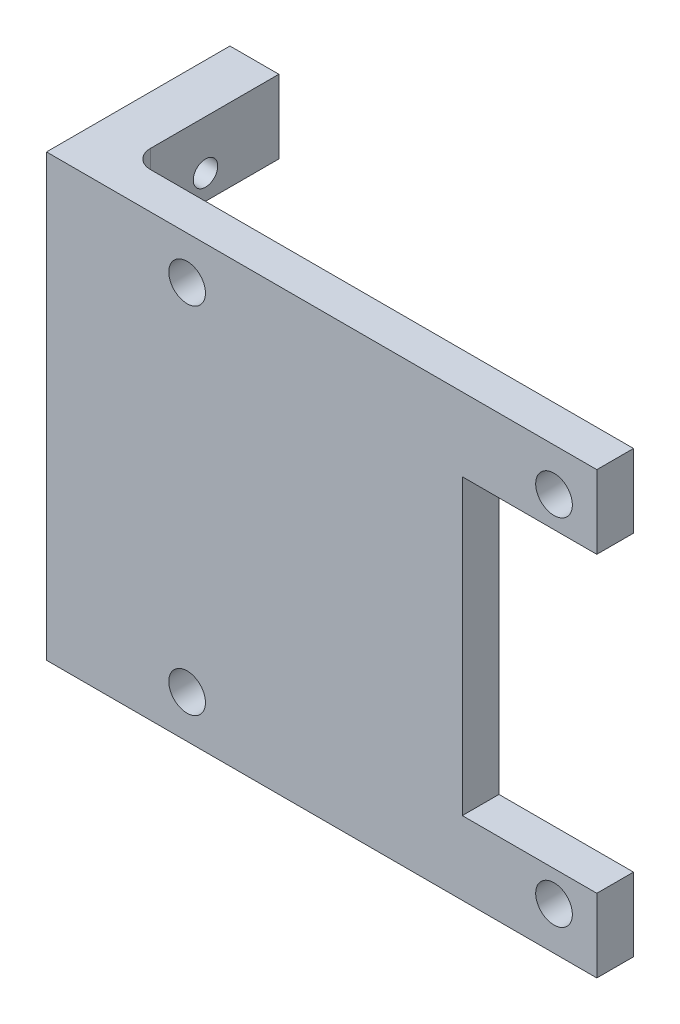
from build123d import *

# Parameters (mm, degrees)
BOSS_EXTRUDE1_DEPTH = 3
CUT_EXTRUDE1_REACH  = 27.986
SKETCH2_R           = 1.5
SKETCH6_W           = 3
SKETCH6_H           = 36
BOSS_EXTRUDE3_DEPTH = 8
SKETCH9_W           = 4
SKETCH9_H           = 6
BOSS_EXTRUDE4_DEPTH = 12
CUT_EXTRUDE2_REACH  = 48.357
SKETCH10_R          = 1
FILLET1_R           = 1.5


with BuildPart() as part:
    # Sketch1 → Boss-Extrude1 (new body)
    with BuildSketch(Plane.XY):
        Polygon((-18.5, 18), (18.5, 18), (18.5, 12), (7.5, 12), (7.5, -12), (18.5, -12), (18.5, -18), (-18.5, -18), align=None)
    extrude(amount=BOSS_EXTRUDE1_DEPTH)

    # Sketch2 → Cut-Extrude1 (cut, up to next)
    with BuildSketch(Plane.XY, mode=Mode.PRIVATE) as cut_extrude1_sk1:
        with Locations((-15, -14.5)):
            Circle(SKETCH2_R)
    cut_extrude1_tool1 = extrude(cut_extrude1_sk1.sketch, amount=CUT_EXTRUDE1_REACH, mode=Mode.PRIVATE) & part.part
    # Sketch2 → Cut-Extrude1 (cut, up to next)
    with BuildSketch(Plane.XY, mode=Mode.PRIVATE) as cut_extrude1_sk2:
        with Locations((15, -14.5)):
            Circle(SKETCH2_R)
    cut_extrude1_tool2 = extrude(cut_extrude1_sk2.sketch, amount=CUT_EXTRUDE1_REACH, mode=Mode.PRIVATE) & part.part
    # Sketch2 → Cut-Extrude1 (cut, up to next)
    with BuildSketch(Plane.XY, mode=Mode.PRIVATE) as cut_extrude1_sk3:
        with Locations((15, 14.5)):
            Circle(SKETCH2_R)
    cut_extrude1_tool3 = extrude(cut_extrude1_sk3.sketch, amount=CUT_EXTRUDE1_REACH, mode=Mode.PRIVATE) & part.part
    # Sketch2 → Cut-Extrude1 (cut, up to next)
    with BuildSketch(Plane.XY, mode=Mode.PRIVATE) as cut_extrude1_sk4:
        with Locations((-15, 14.5)):
            Circle(SKETCH2_R)
    cut_extrude1_tool4 = extrude(cut_extrude1_sk4.sketch, amount=CUT_EXTRUDE1_REACH, mode=Mode.PRIVATE) & part.part
    add(cut_extrude1_tool1.solids().sort_by_distance((-15, -14.5, 0))[0], mode=Mode.SUBTRACT)
    add(cut_extrude1_tool2.solids().sort_by_distance((15, -14.5, 0))[0], mode=Mode.SUBTRACT)
    add(cut_extrude1_tool3.solids().sort_by_distance((15, 14.5, 0))[0], mode=Mode.SUBTRACT)
    add(cut_extrude1_tool4.solids().sort_by_distance((-15, 14.5, 0))[0], mode=Mode.SUBTRACT)

    # Sketch6 → Boss-Extrude3 (add)
    with BuildSketch(Plane.ZY.offset(18.5)):
        with Locations((1.5, 0)):
            Rectangle(SKETCH6_W, SKETCH6_H)
    extrude(amount=BOSS_EXTRUDE3_DEPTH)

    # Sketch9 → Boss-Extrude4 (add)
    with BuildSketch(Plane.XY):
        with Locations((-24.5, 15)):
            Rectangle(SKETCH9_W, SKETCH9_H)
        with Locations((-24.5, -15)):
            Rectangle(SKETCH9_W, SKETCH9_H)
    extrude(amount=-BOSS_EXTRUDE4_DEPTH)

    # Sketch10 → Cut-Extrude2 (cut, up to next)
    with BuildSketch(Plane(origin=(-22.5, 0, 0), x_dir=(0, 0, -1), z_dir=(1, 0, 0)), mode=Mode.PRIVATE) as cut_extrude2_sk1:
        with Locations((6, 14)):
            Circle(SKETCH10_R)
    cut_extrude2_tool1 = extrude(cut_extrude2_sk1.sketch, amount=-CUT_EXTRUDE2_REACH, mode=Mode.PRIVATE) & part.part
    # Sketch10 → Cut-Extrude2 (cut, up to next)
    with BuildSketch(Plane(origin=(-22.5, 0, 0), x_dir=(0, 0, -1), z_dir=(1, 0, 0)), mode=Mode.PRIVATE) as cut_extrude2_sk2:
        with Locations((6, -14)):
            Circle(SKETCH10_R)
    cut_extrude2_tool2 = extrude(cut_extrude2_sk2.sketch, amount=-CUT_EXTRUDE2_REACH, mode=Mode.PRIVATE) & part.part
    add(cut_extrude2_tool1.solids().sort_by_distance((-22.5, 14, -6))[0], mode=Mode.SUBTRACT)
    add(cut_extrude2_tool2.solids().sort_by_distance((-22.5, -14, -6))[0], mode=Mode.SUBTRACT)

    # Fillet1
    fillet1_edges = [part.edges().sort_by_distance(p)[0] for p in [
        (-24.5, 12, 0),
        (-22.5, 15, 0),
        (-22.5, -15, 0),
        (-24.5, -12, 0),
    ]]
    fillet(fillet1_edges, radius=FILLET1_R)


solid = part.part
